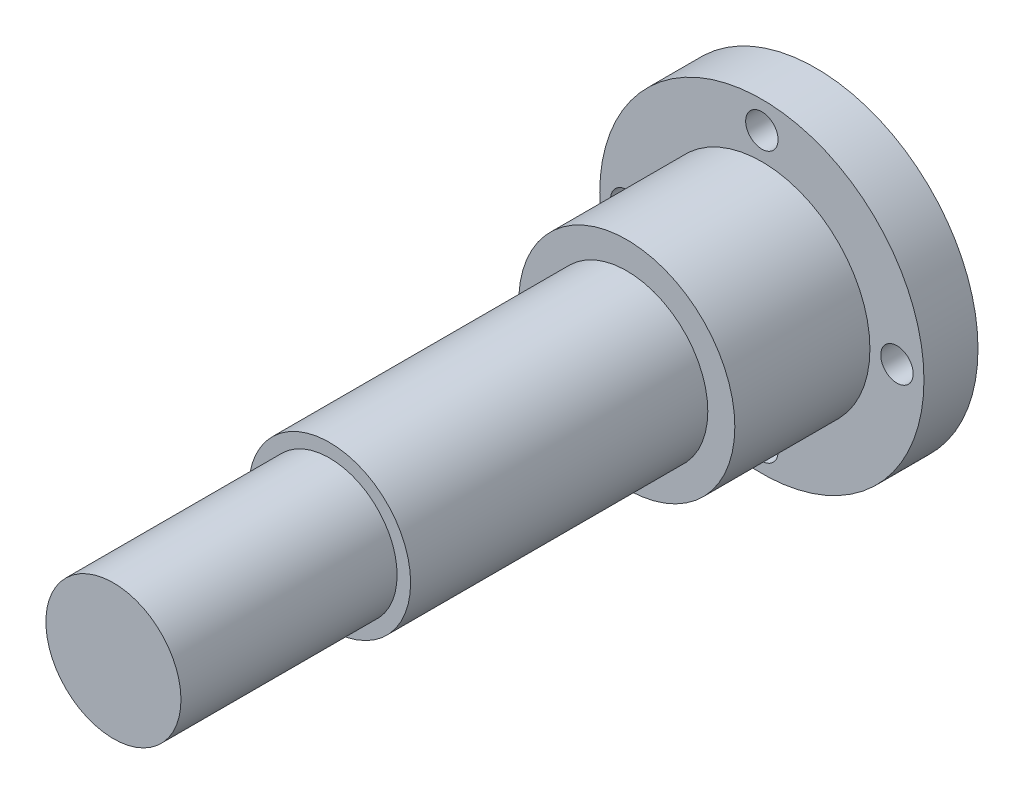
from build123d import *

# Parameters (mm, degrees)
SKETCH3_R           = 30
BOSS_EXTRUDE1_DEPTH = 10
SKETCH4_R           = 20
BOSS_EXTRUDE2_DEPTH = 25
SKETCH5_R           = 15
BOSS_EXTRUDE3_DEPTH = 55
SKETCH6_R           = 12.5
BOSS_EXTRUDE4_DEPTH = 40
SKETCH7_R           = 3
CUT_EXTRUDE1_DEPTH  = 40


with BuildPart() as part:
    # Sketch3 → Boss-Extrude1 (new body)
    with BuildSketch(Plane.XY):
        Circle(SKETCH3_R)
    extrude(amount=BOSS_EXTRUDE1_DEPTH)

    # Sketch4 → Boss-Extrude2 (add)
    with BuildSketch(Plane.XY.offset(10)):
        Circle(SKETCH4_R)
    extrude(amount=BOSS_EXTRUDE2_DEPTH)

    # Sketch5 → Boss-Extrude3 (add)
    with BuildSketch(Plane.XY.offset(35)):
        Circle(SKETCH5_R)
    extrude(amount=BOSS_EXTRUDE3_DEPTH)

    # Sketch6 → Boss-Extrude4 (add)
    with BuildSketch(Plane.XY.offset(90)):
        Circle(SKETCH6_R)
    extrude(amount=BOSS_EXTRUDE4_DEPTH)

    # Sketch7 → Cut-Extrude1 (cut)
    with BuildSketch(Plane.XY.offset(10)):
        with Locations((25, 0)):
            Circle(SKETCH7_R)
        with Locations((0, 25)):
            Circle(SKETCH7_R)
        with Locations((0, -25)):
            Circle(SKETCH7_R)
        with Locations((-25, 0)):
            Circle(SKETCH7_R)
    extrude(amount=-CUT_EXTRUDE1_DEPTH, mode=Mode.SUBTRACT)


solid = part.part
